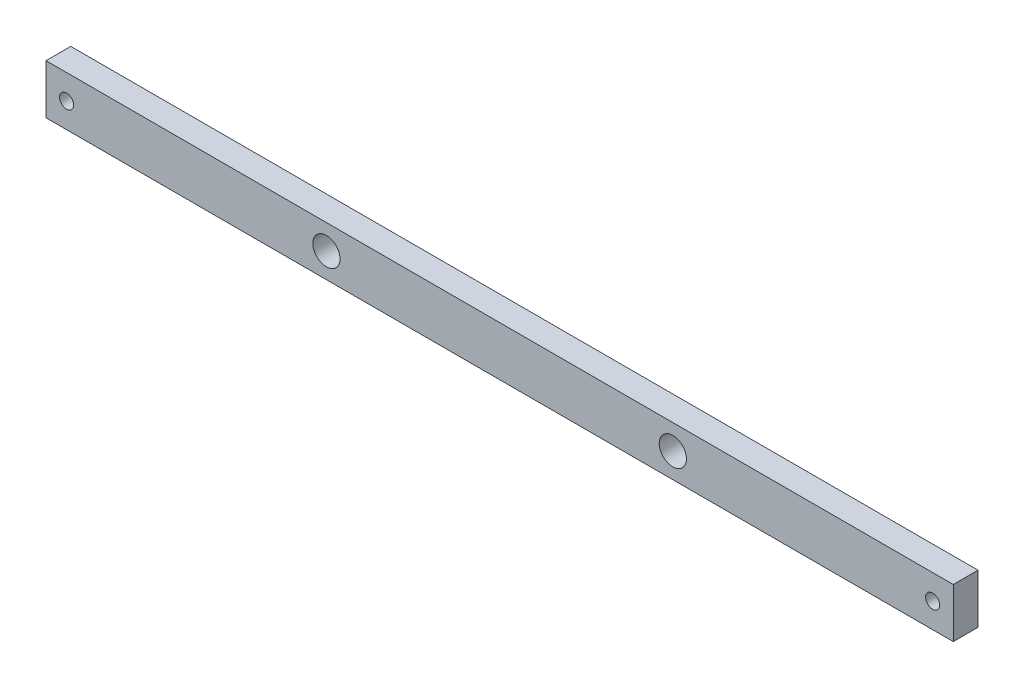
from build123d import *

# Parameters (mm, degrees)
SKETCH1_W              = 220
SKETCH1_H              = 12
SKETCH1_R              = 1.7
SKETCH1_R_2            = 3.3
HEADER_CROSSBEAM_DEPTH = 6


with BuildPart() as part:
    # Sketch1 → Header_Crossbeam (new body)
    with BuildSketch(Plane.XY):
        Rectangle(SKETCH1_W, SKETCH1_H)
        with Locations((-105, 0)):
            Circle(SKETCH1_R, mode=Mode.SUBTRACT)
        with Locations((105, 0)):
            Circle(SKETCH1_R, mode=Mode.SUBTRACT)
        with Locations((-42, 0)):
            Circle(SKETCH1_R_2, mode=Mode.SUBTRACT)
        with Locations((42, 0)):
            Circle(SKETCH1_R_2, mode=Mode.SUBTRACT)
    extrude(amount=HEADER_CROSSBEAM_DEPTH)


solid = part.part
